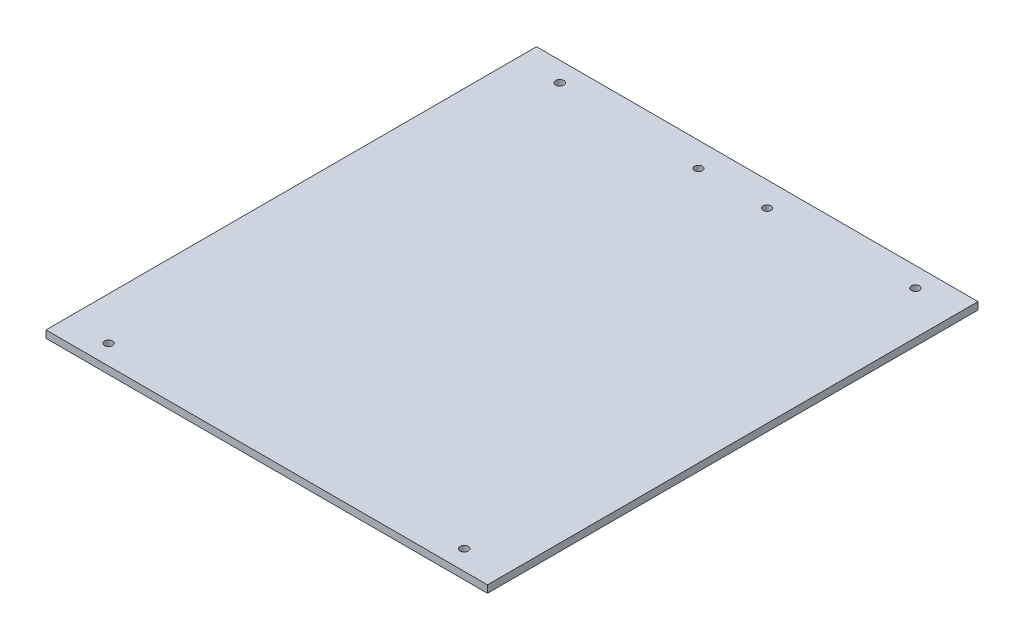
from build123d import *

# Parameters (mm, degrees)
SKETCH1_W           = 180
SKETCH1_H           = 200
BOSS_EXTRUDE1_DEPTH = 3
SKETCH2_R           = 1.65
CUT_EXTRUDE1_DEPTH  = 135.56968455
SKETCH3_R           = 1.6
CUT_EXTRUDE2_DEPTH  = 135.56968455


with BuildPart() as part:
    # Sketch1 → Boss-Extrude1 (new body)
    with BuildSketch(Plane(origin=(0, 0, 0), x_dir=(1, 0, 0), z_dir=(0, 1, 0))):
        Rectangle(SKETCH1_W, SKETCH1_H)
    extrude(amount=BOSS_EXTRUDE1_DEPTH)

    # Sketch2 → Cut-Extrude1 (cut, through all)
    with BuildSketch(Plane(origin=(0, 3, 0), x_dir=(1, 0, 0), z_dir=(0, 1, 0))):
        with Locations((72.5, 92)):
            Circle(SKETCH2_R)
        with Locations((-72.5, 92)):
            Circle(SKETCH2_R)
        with Locations((-72.5, -92)):
            Circle(SKETCH2_R)
        with Locations((72.5, -92)):
            Circle(SKETCH2_R)
    extrude(amount=-CUT_EXTRUDE1_DEPTH, mode=Mode.SUBTRACT)

    # Sketch3 → Cut-Extrude2 (cut, through all)
    with BuildSketch(Plane(origin=(0, 3, 0), x_dir=(1, 0, 0), z_dir=(0, 1, 0))):
        with Locations((14, 90)):
            Circle(SKETCH3_R)
        with Locations((-14, 90)):
            Circle(SKETCH3_R)
    extrude(amount=-CUT_EXTRUDE2_DEPTH, mode=Mode.SUBTRACT)


solid = part.part
